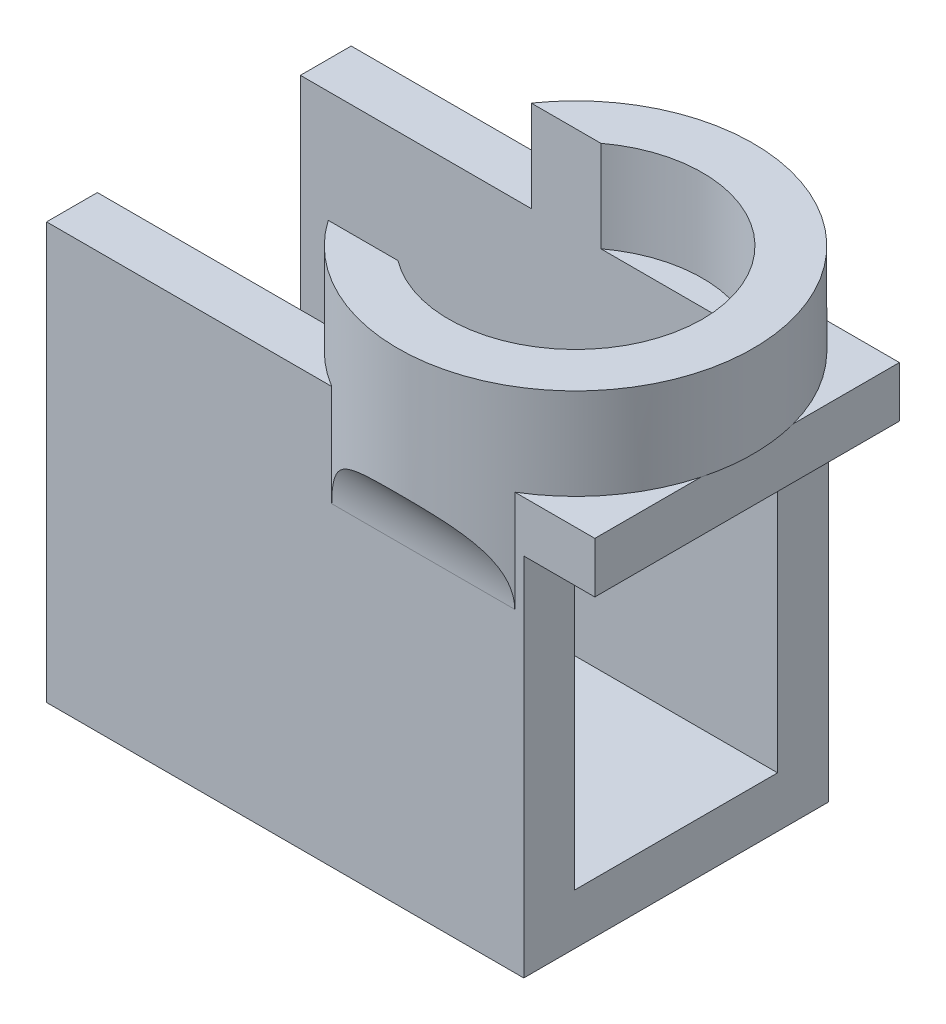
from build123d import *

# Parameters (mm, degrees)
SKETCH1_W           = 54
SKETCH1_H           = 30
BOSS_EXTRUDE1_DEPTH = 5
SKETCH2_W           = 54
SKETCH2_H           = 5
BOSS_EXTRUDE2_DEPTH = 36
SKETCH3_W           = 7
SKETCH3_H           = 20
BOSS_EXTRUDE3_DEPTH = 10
SKETCH6_W           = 7
SKETCH6_H           = 30
CUT_EXTRUDE2_DEPTH  = 36
SKETCH7_R           = 1.5
CUT_EXTRUDE3_DEPTH  = 5
BOSS_EXTRUDE4_DEPTH = 9
FILLET1_R           = 10


with BuildPart() as part:
    # Sketch1 → Boss-Extrude1 (new body)
    with BuildSketch(Plane(origin=(0, 0, 0), x_dir=(1, 0, 0), z_dir=(0, 1, 0))):
        with Locations((27, 15)):
            Rectangle(SKETCH1_W, SKETCH1_H)
    extrude(amount=BOSS_EXTRUDE1_DEPTH)

    # Sketch2 → Boss-Extrude2 (add)
    with BuildSketch(Plane(origin=(0, 5, 0), x_dir=(1, 0, 0), z_dir=(0, 1, 0))):
        with Locations((27, 27.5)):
            Rectangle(SKETCH2_W, SKETCH2_H)
        with Locations((27, 2.5)):
            Rectangle(SKETCH2_W, SKETCH2_H)
    extrude(amount=BOSS_EXTRUDE2_DEPTH)

    # Sketch3 → Boss-Extrude3 (add)
    with BuildSketch(Plane(origin=(0, 41, 0), x_dir=(1, 0, 0), z_dir=(0, 1, 0))):
        with Locations((50.5, 15)):
            Rectangle(SKETCH3_W, SKETCH3_H)
    extrude(amount=-BOSS_EXTRUDE3_DEPTH)

    # Sketch6 → Cut-Extrude2 (cut)
    with BuildSketch(Plane.XZ):
        with Locations((50.5, -15)):
            Rectangle(SKETCH6_W, SKETCH6_H)
    extrude(amount=-CUT_EXTRUDE2_DEPTH, mode=Mode.SUBTRACT)

    # Sketch7 → Cut-Extrude3 (cut)
    with BuildSketch(Plane.ZY):
        with Locations((-27.5, 5)):
            Circle(SKETCH7_R)
        with Locations((-2.5, 5)):
            Circle(SKETCH7_R)
    extrude(amount=-CUT_EXTRUDE3_DEPTH, mode=Mode.SUBTRACT)

    # Sketch8 → Boss-Extrude4 (add)
    with BuildSketch(Plane(origin=(0, 41, 0), x_dir=(1, 0, 0), z_dir=(0, 1, 0))):
        with BuildLine():
            Line((22.738593384, 25), (29.6, 25))
            ThreePointArc((29.6, 25), (49.6, 15), (29.6, 5))
            Line((29.6, 5), (22.738593384, 5))
            ThreePointArc((22.738593384, 5), (54.6, 15), (22.738593384, 25))
        make_face()
    extrude(amount=BOSS_EXTRUDE4_DEPTH)

    # Fillet1
    # the kernel refuses this fillet: 10 mm, written as the material it adds along each edge
    with BuildSketch(Plane(origin=(3.086121811, 41, 0), x_dir=(0, -1, 0), z_dir=(1, 0, 0))) as fillet1_piece_1_section:
        with BuildLine():
            CenterArc((FILLET1_R, -FILLET1_R), FILLET1_R, 90, 90)
            Line((0, -FILLET1_R), (0, 0))
            Line((0, 0), (FILLET1_R, 0))
        make_face()
    fillet1_piece_1 = extrude(amount=68.027756377, mode=Mode.PRIVATE)
    fillet1_piece_1 = fillet1_piece_1 & Plane(origin=(37.1, 34.728997309, -15), x_dir=(-0.82065180664829, 0, 0.5714285714285713), z_dir=(0, -1, 0)) * Cylinder(17.5, 177, mode=Mode.PRIVATE)
    add(fillet1_piece_1)
    with BuildSketch(Plane(origin=(3.086121811, 41, -30), x_dir=(0, -1, 0), z_dir=(1, 0, 0))) as fillet1_piece_2_section:
        with BuildLine():
            CenterArc((FILLET1_R, FILLET1_R), FILLET1_R, 180, 90)
            Line((0, FILLET1_R), (0, 0))
            Line((0, 0), (FILLET1_R, 0))
        make_face()
    fillet1_piece_2 = extrude(amount=68.027756377, mode=Mode.PRIVATE)
    fillet1_piece_2 = fillet1_piece_2 & Plane(origin=(37.1, 34.728997309, -15), x_dir=(-0.82065180664829, 0, 0.5714285714285713), z_dir=(0, -1, 0)) * Cylinder(17.5, 177, mode=Mode.PRIVATE)
    add(fillet1_piece_2)


solid = part.part
